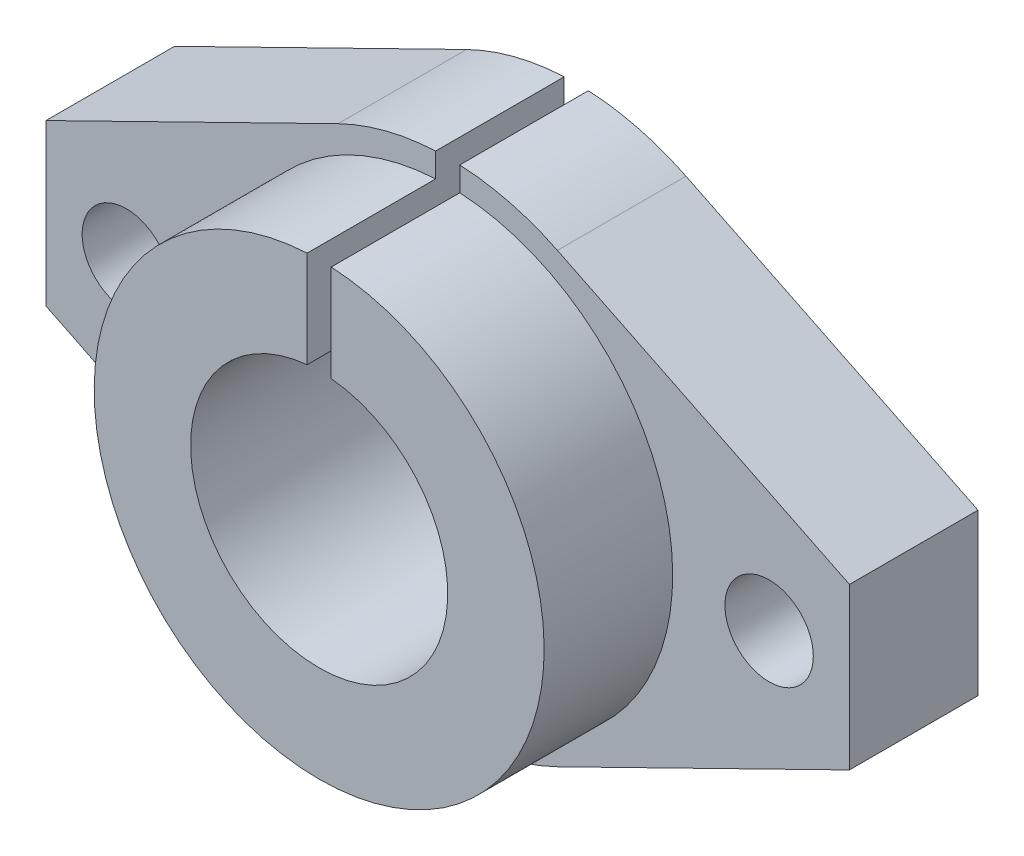
from build123d import *

# Parameters (mm, degrees)
BOSS_EXTRUDE1_DEPTH = 8
SKETCH2_R           = 14
BOSS_EXTRUDE2_DEPTH = 8
SKETCH3_R           = 8
CUT_EXTRUDE1_DEPTH  = 34.485071301
SKETCH4_R           = 2.75
CUT_EXTRUDE2_DEPTH  = 31.483602149
SKETCH5_W           = 1.5
SKETCH5_H           = 20
CUT_EXTRUDE3_DEPTH  = 34.485071301


with BuildPart() as part:
    # Sketch1 → Boss-Extrude1 (new body)
    with BuildSketch(Plane.XY):
        with BuildLine():
            Line((-6.826881704, 13.915591478), (-25, 5))
            Line((-25, 5), (-25, -5))
            Line((-25, -5), (-6.826881704, -13.915591478))
            ThreePointArc((-6.826881704, -13.915591478), (0, -15.5), (6.826881704, -13.915591478))
            Line((6.826881704, -13.915591478), (25, -5))
            Line((25, -5), (25, 5))
            Line((25, 5), (6.826881704, 13.915591478))
            ThreePointArc((6.826881704, 13.915591478), (0, 15.5), (-6.826881704, 13.915591478))
        make_face()
    extrude(amount=BOSS_EXTRUDE1_DEPTH)

    # Sketch2 → Boss-Extrude2 (add)
    with BuildSketch(Plane.XY.offset(8)):
        Circle(SKETCH2_R)
    extrude(amount=BOSS_EXTRUDE2_DEPTH)

    # Sketch3 → Cut-Extrude1 (cut, through all)
    with BuildSketch(Plane.XY.offset(16)):
        Circle(SKETCH3_R)
    extrude(amount=-CUT_EXTRUDE1_DEPTH, mode=Mode.SUBTRACT)

    # Sketch4 → Cut-Extrude2 (cut, through all)
    with BuildSketch(Plane.XY.offset(8)):
        with Locations((-20, 0)):
            Circle(SKETCH4_R)
        with Locations((20, 0)):
            Circle(SKETCH4_R)
    extrude(amount=-CUT_EXTRUDE2_DEPTH, mode=Mode.SUBTRACT)

    # Sketch5 → Cut-Extrude3 (cut, through all)
    with BuildSketch(Plane.XY.offset(16)):
        with Locations((0, 15)):
            Rectangle(SKETCH5_W, SKETCH5_H)
    extrude(amount=-CUT_EXTRUDE3_DEPTH, mode=Mode.SUBTRACT)


solid = part.part
